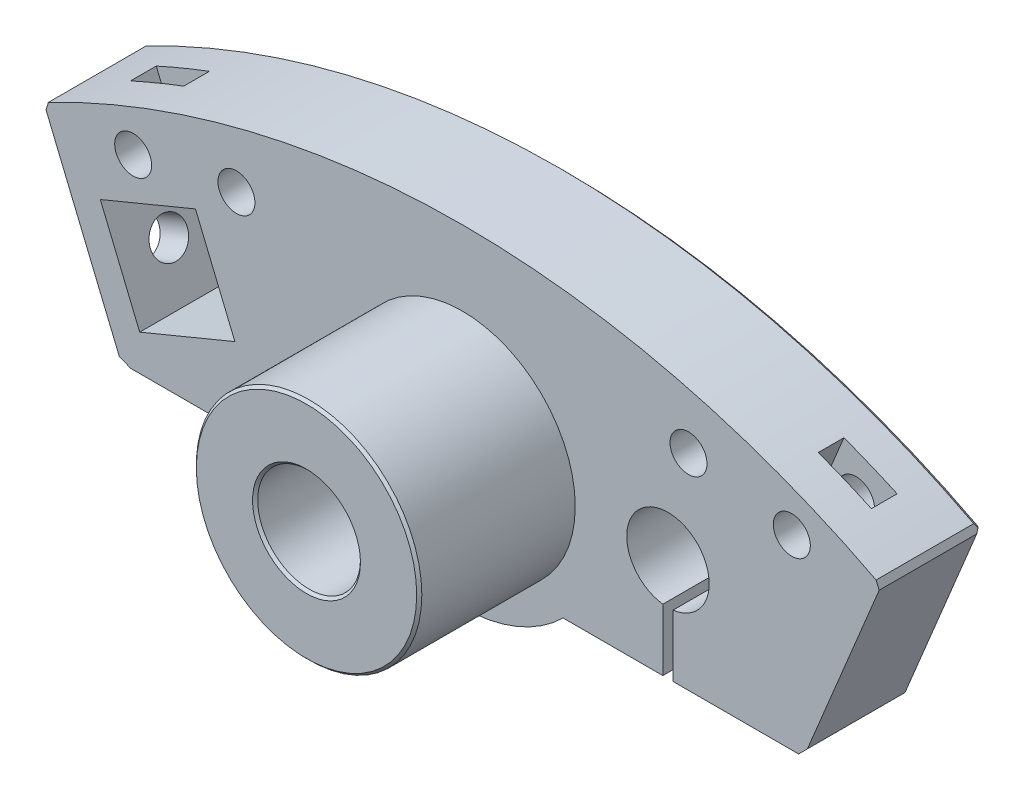
from build123d import *

# Parameters (mm, degrees)
SKETCH1_R           = 5
SKETCH1_R_2         = 1.8
BOSS_EXTRUDE1_DEPTH = 10
CHAMFER1_SIZE       = 0.5
CUT_EXTRUDE2_DEPTH  = 2.5
CHAMFER2_SIZE       = 0.5
SKETCH4_R           = 1.8
CUT_EXTRUDE3_DEPTH  = 10
CHAMFER3_SIZE       = 0.5
CHAMFER3_SIZE_2     = 0.923879533
CHAMFER3_SIZE_3     = 0.552958444
SKETCH7_R           = 10.975
SKETCH7_R_2         = 5
BOSS_EXTRUDE2_DEPTH = 15.18
SKETCH8_R           = 8.5125
CUT_EXTRUDE6_DEPTH  = 11.18
SKETCH9_R           = 9.5125
CUT_EXTRUDE8_DEPTH  = 6.32
CHAMFER4_SIZE       = 0.25


with BuildPart() as part:
    # Sketch1 → Boss-Extrude1 (new body)
    with BuildSketch(Plane.XY):
        with BuildLine():
            Line((-40.746699048, 8.183561953), (-33.214821075, -10))
            Line((-33.214821075, -10), (-9.797958971, -10))
            ThreePointArc((-9.797958971, -10), (0, -14), (9.797958971, -10))
            Line((9.797958971, -10), (19.5, -10))
            Line((19.5, -10), (19.5, -3.981225471))
            ThreePointArc((19.5, -3.981225471), (20, 4.0125), (20.5, -3.981225471))
            Line((20.5, -3.981225471), (20.5, -10))
            Line((20.5, -10), (33.214821075, -10))
            Line((33.214821075, -10), (40.746699048, 8.183561953))
            ThreePointArc((40.746699048, 8.183561953), (0, 18.25), (-40.746699048, 8.183561953))
        make_face()
        Circle(SKETCH1_R, mode=Mode.SUBTRACT)
        with Locations((-32.052211881, 8.130884627)):
            Circle(SKETCH1_R_2, mode=Mode.SUBTRACT)
        with Locations(Location((32.052211881, 8.130884627, 0), (0, 0, 180))):
            Circle(SKETCH1_R_2, mode=Mode.SUBTRACT)
        with Locations((-22, 10)):
            Circle(SKETCH1_R_2, mode=Mode.SUBTRACT)
        with Locations(Location((22, 10, 0), (0, 0, 180))):
            Circle(SKETCH1_R_2, mode=Mode.SUBTRACT)
        Polygon((-25.988511975, 6.5901118), (-35.250404289, 2.75371039), (-31.414002879, -6.508181923), (-22.152110566, -2.671780514), align=None, mode=Mode.SUBTRACT)
    extrude(amount=BOSS_EXTRUDE1_DEPTH)

    # Chamfer1
    chamfer1_edges = [part.edges().sort_by_distance(p)[0] for p in [
        (20, 4.0125, 0),
        (-24.070311271, 1.959165643, 0),
        (-30.619458132, 4.671911095, 0),
        (-33.332203584, -1.877235766, 0),
        (-26.783056723, -4.589981218, 0),
    ]]
    chamfer(chamfer1_edges, length=CHAMFER1_SIZE)

    # Sketch3 → Cut-Extrude2 (cut)
    with BuildSketch(Plane.XY.offset(3.75)):
        Polygon((-37.076762037, 12.944469155), (-33.567560961, 4.472508325), (-28.393835579, 6.615535546), (-31.903036655, 15.087496376), align=None)
        Polygon((37.076762037, 12.944469155), (33.567560961, 4.472508325), (28.393835579, 6.615535546), (31.903036655, 15.087496376), align=None)
    extrude(amount=CUT_EXTRUDE2_DEPTH, mode=Mode.SUBTRACT)

    # Chamfer2
    chamfer2_edges = [part.edges().sort_by_distance(p)[0] for p in [
        (14.648979486, -10, 0),
        (0, -14, 0),
        (-21.506390023, -10, 0),
        (-36.980760062, -0.908219024, 0),
        (0, 18.25, 0),
        (36.980760062, -0.908219024, 0),
        (26.857410538, -10, 0),
    ]]
    chamfer(chamfer2_edges, length=CHAMFER2_SIZE)

    # Sketch4 → Cut-Extrude3 (cut)
    with BuildSketch(Plane(origin=(-29.114518455, -12.059628406, 0), x_dir=(0, 0, -1), z_dir=(0.9238795325112882, 0.38268343236508634, 0))):
        with Locations(Location((-5.25, 11.021342374, 0), (0, 0, 90))):
            Circle(SKETCH4_R)
    extrude(amount=-CUT_EXTRUDE3_DEPTH, mode=Mode.SUBTRACT)

    # Chamfer3
    # the kernel refuses this chamfer: 0.923879533, 0.552958444, 0.5 mm, written as the material it takes off along each edge
    with BuildSketch(Plane(origin=(40.746699048, 8.183561953, -0.920037939), x_dir=(-0.38268343236508906, -0.923879532511287, 0), z_dir=(0, 0, 1))) as chamfer3_piece_1:
        with BuildLine():
            Line((CHAMFER3_SIZE, 0), (-0.048717445, -0.548717445))
            ThreePointArc((-0.048717445, -0.548717445), (-0.025540103, -0.282767493), (0, 0))
            Line((0, 0), (CHAMFER3_SIZE, 0))
        make_face()
    extrude(amount=12.340075878, mode=Mode.SUBTRACT)
    with BuildSketch(Plane(origin=(33.214821075, -10, -1.895315111), x_dir=(-1, 0, 0), z_dir=(0, 0, 1)), Plane(origin=(-33.214821075, -10, -1.895315111), x_dir=(-0.38268343236508656, 0.9238795325112881, 0), z_dir=(0, 0, 1))) as chamfer3_piece_2:
        Polygon((CHAMFER3_SIZE, 0), (-CHAMFER3_SIZE_2 * 0.382683432163, -CHAMFER3_SIZE_2 * 0.923879532023), (0, 0), align=None)
    extrude(amount=14.290630221, mode=Mode.SUBTRACT)
    with BuildSketch(Plane(origin=(-40.746699048, 8.183561953, -0.925350902), x_dir=(0.38268343236508684, -0.9238795325112881, 0), z_dir=(0, 0, 1))) as chamfer3_piece_3:
        with BuildLine():
            Line((CHAMFER3_SIZE_3, 0), (-0.04424113, 0.496614821))
            ThreePointArc((-0.04424113, 0.496614821), (-0.0231658, 0.256042208), (0, 0))
            Line((0, 0), (CHAMFER3_SIZE_3, 0))
        make_face()
    extrude(amount=12.350701805, mode=Mode.SUBTRACT)

    # Sketch7 → Boss-Extrude2 (add)
    with BuildSketch(Plane.XY.offset(10)):
        Circle(SKETCH7_R)
        Circle(SKETCH7_R_2, mode=Mode.SUBTRACT)
    extrude(amount=BOSS_EXTRUDE2_DEPTH)

    # Sketch8 → Cut-Extrude6 (cut)
    with BuildSketch(Plane.XY):
        with Locations(Location((0, 0, 0), (0, 0, 180))):
            Circle(SKETCH8_R)
    extrude(amount=CUT_EXTRUDE6_DEPTH, mode=Mode.SUBTRACT)

    # Sketch9 → Cut-Extrude8 (cut)
    with BuildSketch(Plane.XY):
        with Locations(Location((0, 0, 0), (0, 0, 180))):
            Circle(SKETCH9_R)
    extrude(amount=CUT_EXTRUDE8_DEPTH, mode=Mode.SUBTRACT)

    # Chamfer4
    chamfer4_edges = [part.edges().sort_by_distance(p)[0] for p in [
        (-10.975, 0, 25.18),
        (-5, 0, 25.18),
        (8.5125, 0, 6.32),
    ]]
    chamfer(chamfer4_edges, length=CHAMFER4_SIZE)


solid = part.part
